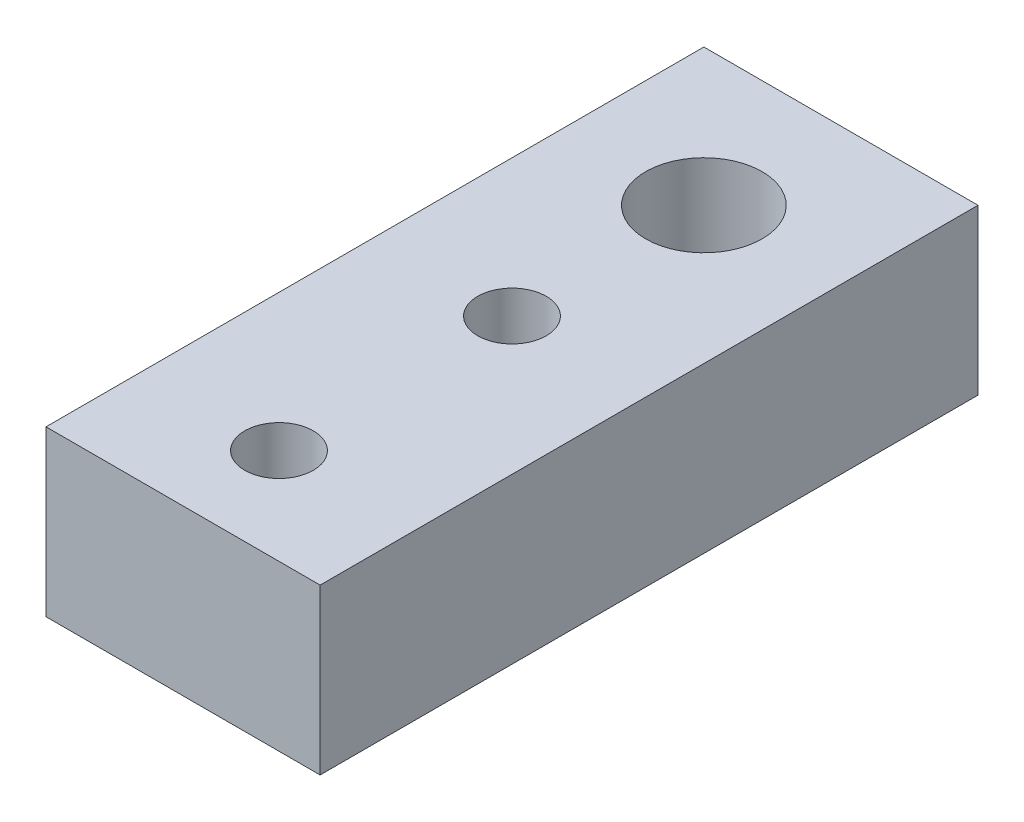
from build123d import *

# Parameters (mm, degrees)
SKETCH1_W              = 20
SKETCH1_H              = 12
BOSS_EXTRUDE1_DEPTH    = 24
M6X1_0_TAPPED_HOLE1_D  = 5
M10X1_5_TAPPED_HOLE1_D = 8.5


with BuildPart() as part:
    # Sketch1 → Boss-Extrude1 (new, symmetric)
    with BuildSketch(Plane.XY):
        Rectangle(SKETCH1_W, SKETCH1_H)
    extrude(amount=BOSS_EXTRUDE1_DEPTH, both=True)

    # M6x1.0 Tapped Hole1 (through all)
    with Locations(Plane(origin=(0, 6, 0), x_dir=(1, 0, 0), z_dir=(0, 1, 0))):
        with Locations((0, -17), (0, 0), (0, 14)):
            Hole(M6X1_0_TAPPED_HOLE1_D / 2)

    # M10x1.5 Tapped Hole1 (through all)
    with Locations(Plane(origin=(0, 6, 0), x_dir=(1, 0, 0), z_dir=(0, 1, 0))):
        with Locations((0, 14)):
            Hole(M10X1_5_TAPPED_HOLE1_D / 2)


solid = part.part
